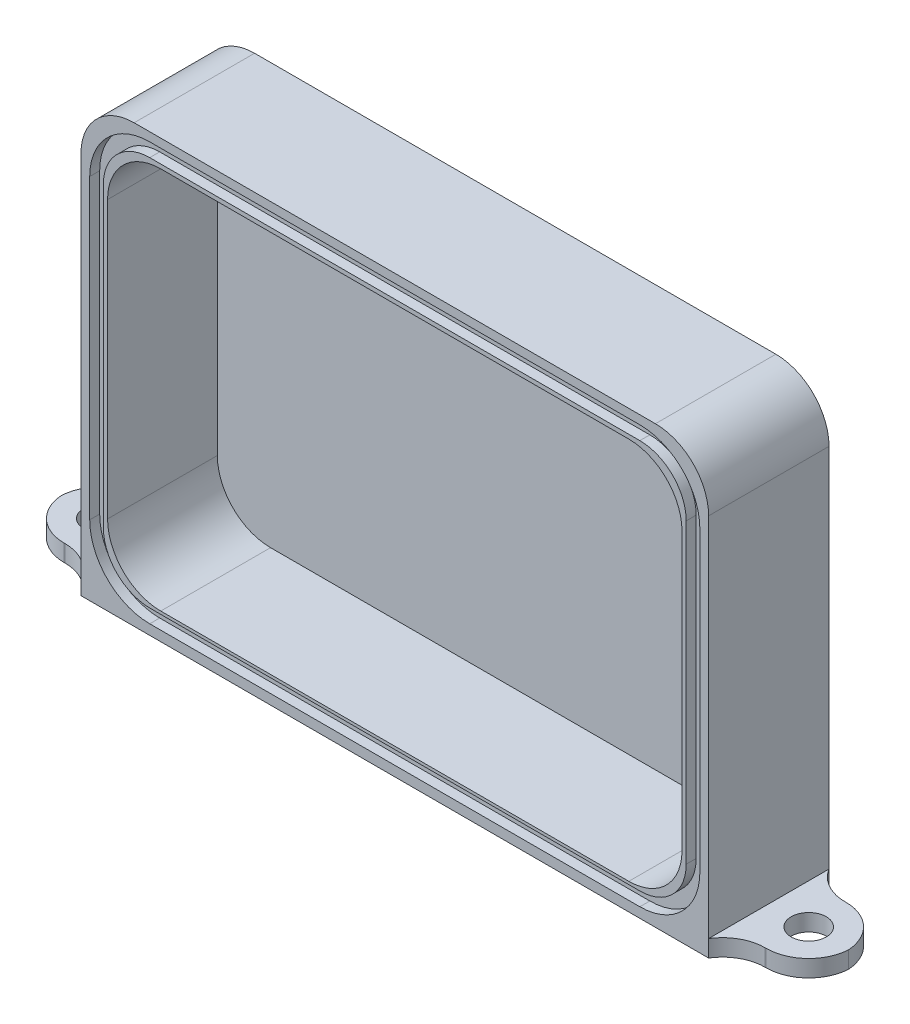
from build123d import *

# Parameters (mm, degrees)
SKETCH2_W           = 108
SKETCH2_H           = 72
BOSS_EXTRUDE1_DEPTH = 20.64
SHELL1_T            = 5
SKETCH3_W           = 118
SKETCH3_H           = 82
CUT_EXTRUDE1_DEPTH  = 3
SKETCH4_W           = 15
SKETCH4_H           = 15
SKETCH4_R           = 3.3
BOSS_EXTRUDE2_DEPTH = 3.175
FILLET1_R           = 10
FILLET2_R           = 8
CUT_EXTRUDE2_DEPTH  = 1.875


with BuildPart() as part:
    # Sketch2 → Boss-Extrude1 (new body)
    with BuildSketch(Plane.XY):
        Rectangle(SKETCH2_W, SKETCH2_H)
    extrude(amount=BOSS_EXTRUDE1_DEPTH)

    # Shell1
    shell1_openings = [part.faces().sort_by_distance(p)[0] for p in [
        (0, 0, 20.64),
    ]]
    offset(amount=SHELL1_T, openings=shell1_openings, kind=Kind.INTERSECTION)

    # Sketch3 → Cut-Extrude1 (cut)
    with BuildSketch(Plane(origin=(0, 0, -5), x_dir=(-1, 0, 0), z_dir=(0, 0, -1))):
        Rectangle(SKETCH3_W, SKETCH3_H)
    extrude(amount=-CUT_EXTRUDE1_DEPTH, mode=Mode.SUBTRACT)

    # Sketch4 → Boss-Extrude2 (add)
    # profile 1 of 2: a face of its own
    with BuildSketch(Plane.XZ.offset(41)):
        with Locations((-66.5, 9.32)):
            Rectangle(SKETCH4_W, SKETCH4_H)
        with Locations(Location((-66.5, 9.32, 0), (0, 0, 270))):
            Circle(SKETCH4_R, mode=Mode.SUBTRACT)
    # profile 2 of 2: a face of its own
    with BuildSketch(Plane.XZ.offset(41)):
        with Locations((66.5, 9.32)):
            Rectangle(SKETCH4_W, SKETCH4_H)
        with Locations(Location((66.5, 9.32, 0), (0, 0, 270))):
            Circle(SKETCH4_R, mode=Mode.SUBTRACT)
    extrude(amount=-BOSS_EXTRUDE2_DEPTH)

    # Fillet1
    fillet1_edges = [part.edges().sort_by_distance(p)[0] for p in [
        (54, -36, 10.32),
        (54, 36, 10.32),
        (-54, 36, 10.32),
        (-54, -36, 10.32),
        (-59, 41, 9.32),
        (59, 41, 9.32),
    ]]
    fillet(fillet1_edges, radius=FILLET1_R)

    # Fillet2
    # the kernel refuses this fillet: 8 mm, written as the material it adds along each edge
    with BuildSketch(Plane(origin=(59, -41, 16.82), x_dir=(0, 0, 1), z_dir=(0, 1, 0)), Plane(origin=(-59, -41, 1.82), x_dir=(0, 0, -1), z_dir=(0, 1, 0))) as fillet2_piece_1:
        with BuildLine():
            CenterArc((8, 6.821114278), FILLET2_R, 180, 58.499903552)
            Line((0, 6.821114278), (0, 0))
            Line((0, 0), (3.82, 0))
        make_face()
    extrude(amount=3.175)
    with BuildSketch(Plane(origin=(59, -41, 1.82), x_dir=(0, 0, -1), z_dir=(0, 1, 0)), Plane(origin=(-59, -41, 16.82), x_dir=(0, 0, 1), z_dir=(0, 1, 0))) as fillet2_piece_2:
        with BuildLine():
            CenterArc((8, -6.821114278), FILLET2_R, 121.500096448, 58.499903552)
            Line((0, -6.821114278), (0, 0))
            Line((0, 0), (3.82, 0))
        make_face()
    extrude(amount=3.175)
    # the kernel refuses this fillet: 8 mm, written as the material it takes off along each edge
    with BuildSketch(Plane(origin=(74, -61, 16.82), x_dir=(0, 0, -1), z_dir=(0, 1, 0)), Plane(origin=(-74, -61, 1.82), x_dir=(0, 0, 1), z_dir=(0, 1, 0)), Plane(origin=(-74, -61, 16.82), x_dir=(1, 0, 0), z_dir=(0, 1, 0))) as fillet2_2_piece_1:
        with BuildLine():
            CenterArc((FILLET2_R, FILLET2_R), FILLET2_R, 180, 90)
            Line((0, FILLET2_R), (0, 0))
            Line((0, 0), (FILLET2_R, 0))
        make_face()
    extrude(amount=43.175, mode=Mode.SUBTRACT)
    with BuildSketch(Plane(origin=(74, -61, 1.82), x_dir=(0, 0, 1), z_dir=(0, 1, 0))) as fillet2_2_piece_2:
        with BuildLine():
            CenterArc((FILLET2_R, -FILLET2_R), FILLET2_R, 90, 90)
            Line((0, -FILLET2_R), (0, 0))
            Line((0, 0), (FILLET2_R, 0))
        make_face()
    extrude(amount=43.175, mode=Mode.SUBTRACT)

    # Sketch5 → Cut-Extrude2 (cut)
    with BuildSketch(Plane.XY.offset(20.64)):
        with BuildLine():
            Line((46.071067812, -39.11), (-46.071067812, -39.11))
            ThreePointArc((-46.071067812, -39.11), (-54.050767838, -35.804700026), (-57.356067812, -27.825))
            Line((-57.356067812, -27.825), (-57.356067812, 28.071067812))
            ThreePointArc((-57.356067812, 28.071067812), (-54.050767838, 36.050767838), (-46.071067812, 39.356067812))
            Line((-46.071067812, 39.356067812), (46.071067812, 39.356067812))
            ThreePointArc((46.071067812, 39.356067812), (54.050767838, 36.050767838), (57.356067812, 28.071067812))
            Line((57.356067812, 28.071067812), (57.356067812, -27.825))
            ThreePointArc((57.356067812, -27.825), (54.050767838, -35.804700026), (46.071067812, -39.11))
        make_face()
        with BuildLine():
            Line((46.071067812, -36.54), (-46.071067812, -36.54))
            ThreePointArc((-46.071067812, -36.54), (-52.23350341, -33.987435598), (-54.786067812, -27.825))
            Line((-54.786067812, -27.825), (-54.786067812, 28.071067812))
            ThreePointArc((-54.786067812, 28.071067812), (-52.23350341, 34.23350341), (-46.071067812, 36.786067812))
            Line((-46.071067812, 36.786067812), (46.071067812, 36.786067812))
            ThreePointArc((46.071067812, 36.786067812), (52.23350341, 34.23350341), (54.786067812, 28.071067812))
            Line((54.786067812, 28.071067812), (54.786067812, -27.825))
            ThreePointArc((54.786067812, -27.825), (52.23350341, -33.987435598), (46.071067812, -36.54))
        make_face(mode=Mode.SUBTRACT)
    extrude(amount=-CUT_EXTRUDE2_DEPTH, mode=Mode.SUBTRACT)


solid = part.part
